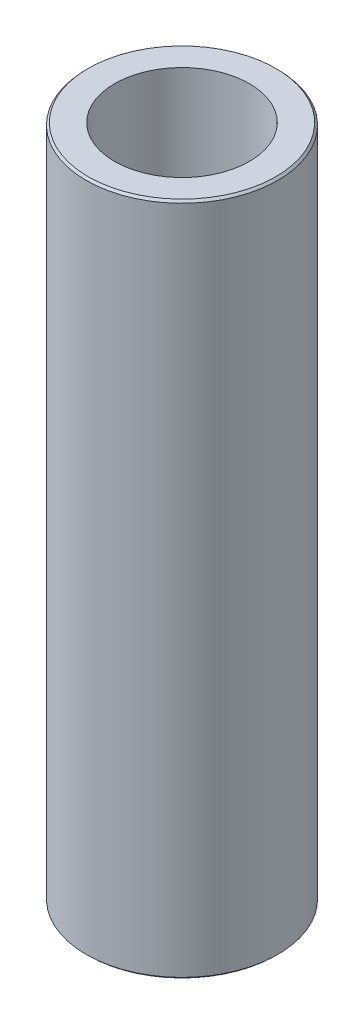
from build123d import *
from OCP.BRepFilletAPI import BRepFilletAPI_MakeChamfer

# Parameters (mm, degrees)
SKETCH1_R           = 50
BOSS_EXTRUDE1_DEPTH = 351.867280979
SKETCH2_R           = 35.16849875
CUT_EXTRUDE1_DEPTH  = 359.901913374
CHAMFER1_SIZE       = 1.124185989
CHAMFER1_SIZE2      = 1.06089008


with BuildPart() as part:
    # Sketch1 → Boss-Extrude1 (new body)
    with BuildSketch(Plane(origin=(0, 0, 0), x_dir=(1, 0, 0), z_dir=(0, 1, 0))):
        Circle(SKETCH1_R)
    extrude(amount=BOSS_EXTRUDE1_DEPTH)

    # Sketch2 → Cut-Extrude1 (cut, through all)
    with BuildSketch(Plane(origin=(0, 0, 0), x_dir=(1, 0, 0), z_dir=(0, 1, 0))):
        Circle(SKETCH2_R)
    extrude(amount=CUT_EXTRUDE1_DEPTH, mode=Mode.SUBTRACT)

    # Chamfer1: one chamfer whose edges measure the first distance from different faces: ONE call of the kernel's chamfer builder (chamfer() names one face for all edges)
    chamfer1_edges_1 = [part.edges().sort_by_distance(p)[0] for p in [
        (-50, 351.867280979, 0),
    ]]
    chamfer1_side_1 = [part.faces().sort_by_distance(p)[0] for p in [
        (-50, 175.933640489, 0),
    ]]
    chamfer1_edges_2 = [part.edges().sort_by_distance(p)[0] for p in [
        (-50, 0, 0),
    ]]
    chamfer1_side_2 = [part.faces().sort_by_distance(p)[0] for p in [
        (-48.585786438, 0, 0),
    ]]
    chamfer1 = BRepFilletAPI_MakeChamfer(part.part.solid().wrapped)
    for e in chamfer1_edges_1:
        chamfer1.Add(CHAMFER1_SIZE, CHAMFER1_SIZE2, e.wrapped, chamfer1_side_1[0].wrapped)  # the first distance lies on this face
    for e in chamfer1_edges_2:
        chamfer1.Add(CHAMFER1_SIZE, CHAMFER1_SIZE2, e.wrapped, chamfer1_side_2[0].wrapped)  # the first distance lies on this face
    add(Compound.cast(chamfer1.Shape()), mode=Mode.REPLACE)


solid = part.part
